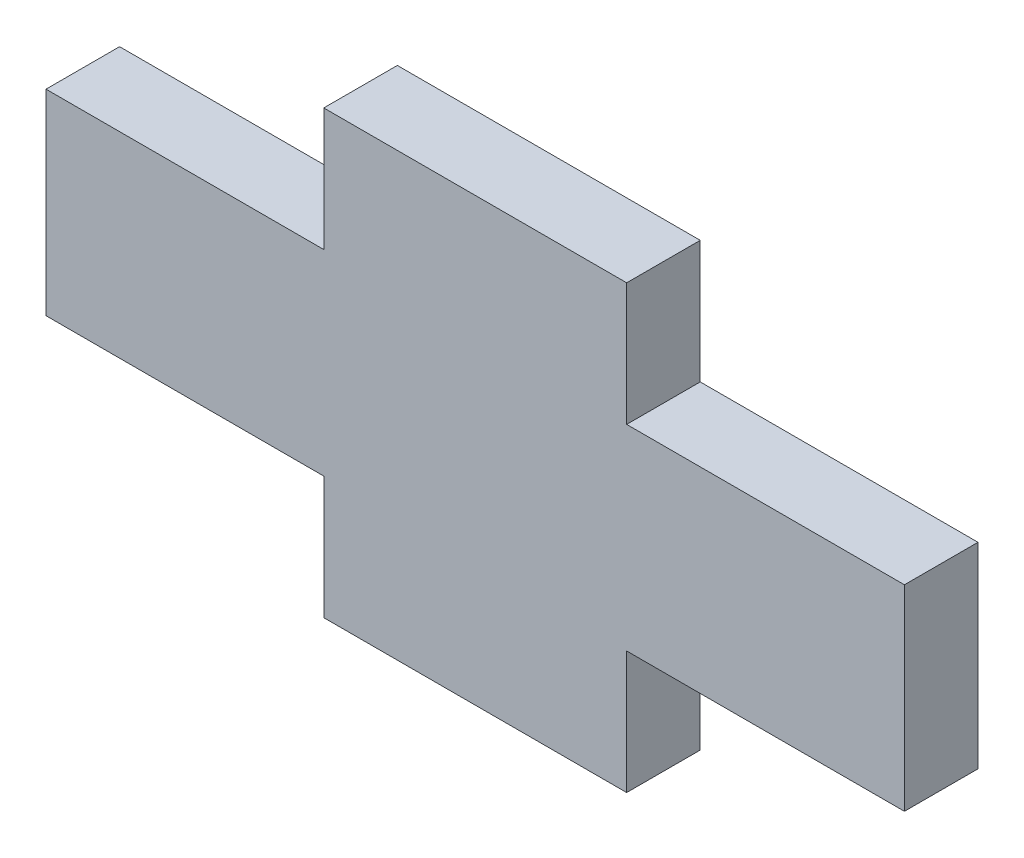
from build123d import *

# Parameters (mm, degrees)
DODANIE_WYCI_GNI_CIE1_DEPTH = 1.5


with BuildPart() as part:
    # Szkic1 → Dodanie-wyciągnięcie1 (new, symmetric)
    with BuildSketch(Plane.XY):
        Polygon((-17.5, -4), (-17.5, 4), (-6.175, 4), (-6.175, 9), (6.175, 9), (6.175, 4), (17.5, 4), (17.5, -4), (6.175, -4), (6.175, -9), (-6.175, -9), (-6.175, -4), align=None)
    extrude(amount=DODANIE_WYCI_GNI_CIE1_DEPTH, both=True)


solid = part.part
